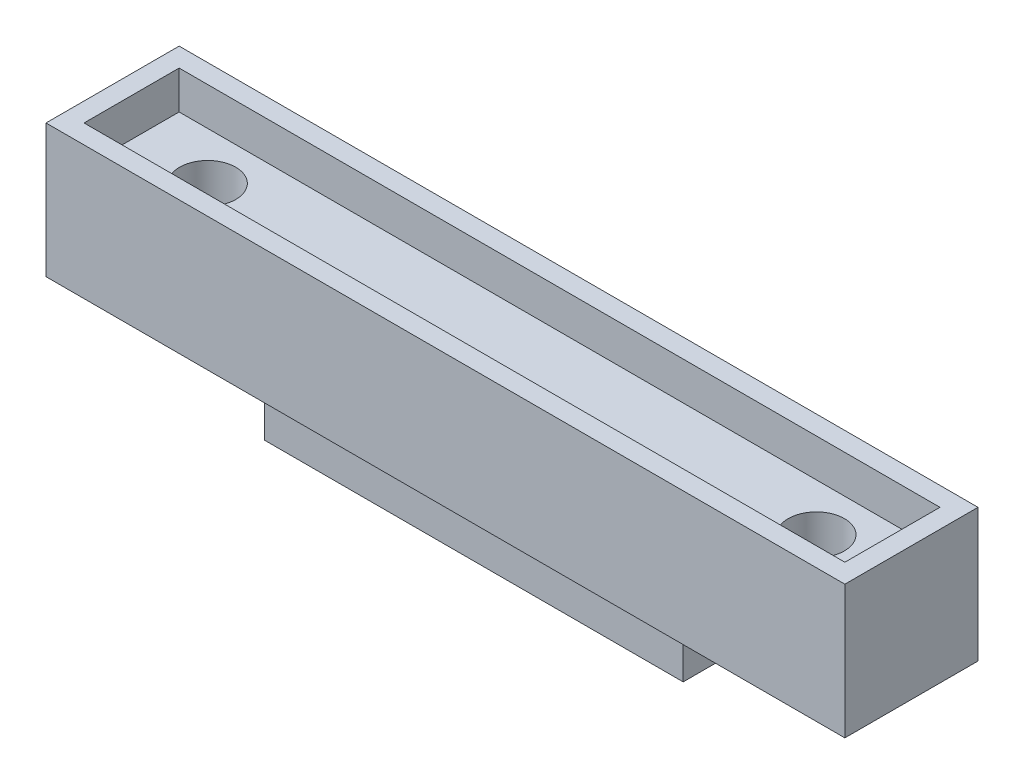
from build123d import *

# Parameters (mm, degrees)
SKETCH1_W            = 42
SKETCH1_H            = 7
RISER_DEPTH          = 7
SKETCH2_R            = 1.475
MOUNTING_HOLES_DEPTH = 44.150898021
SKETCH3_W            = 40
SKETCH3_H            = 5
RECESS_4_SIDES_DEPTH = 2
SKETCH5_W            = 22
SKETCH5_H            = 4
ALIGNMENT_TAB_DEPTH  = 3.2


with BuildPart() as part:
    # Sketch1 → Riser (new body)
    with BuildSketch(Plane(origin=(0, 0, 0), x_dir=(1, 0, 0), z_dir=(0, 1, 0))):
        with Locations((21, 3.5)):
            Rectangle(SKETCH1_W, SKETCH1_H)
    extrude(amount=RISER_DEPTH)

    # Sketch2 → Mounting Holes (cut, through all)
    with BuildSketch(Plane.XZ):
        with Locations((5, -3.5)):
            Circle(SKETCH2_R)
        with Locations((37, -3.5)):
            Circle(SKETCH2_R)
    extrude(amount=-MOUNTING_HOLES_DEPTH, mode=Mode.SUBTRACT)

    # Sketch3 → Recess (4-Sides) (cut)
    with BuildSketch(Plane(origin=(0, 7, 0), x_dir=(1, 0, 0), z_dir=(0, 1, 0))):
        with Locations((21, 3.5)):
            Rectangle(SKETCH3_W, SKETCH3_H)
    extrude(amount=-RECESS_4_SIDES_DEPTH, mode=Mode.SUBTRACT)

    # Sketch5 → Alignment Tab (add)
    with BuildSketch(Plane.XZ):
        with Locations((21, -3.5)):
            Rectangle(SKETCH5_W, SKETCH5_H)
    extrude(amount=ALIGNMENT_TAB_DEPTH)


solid = part.part
